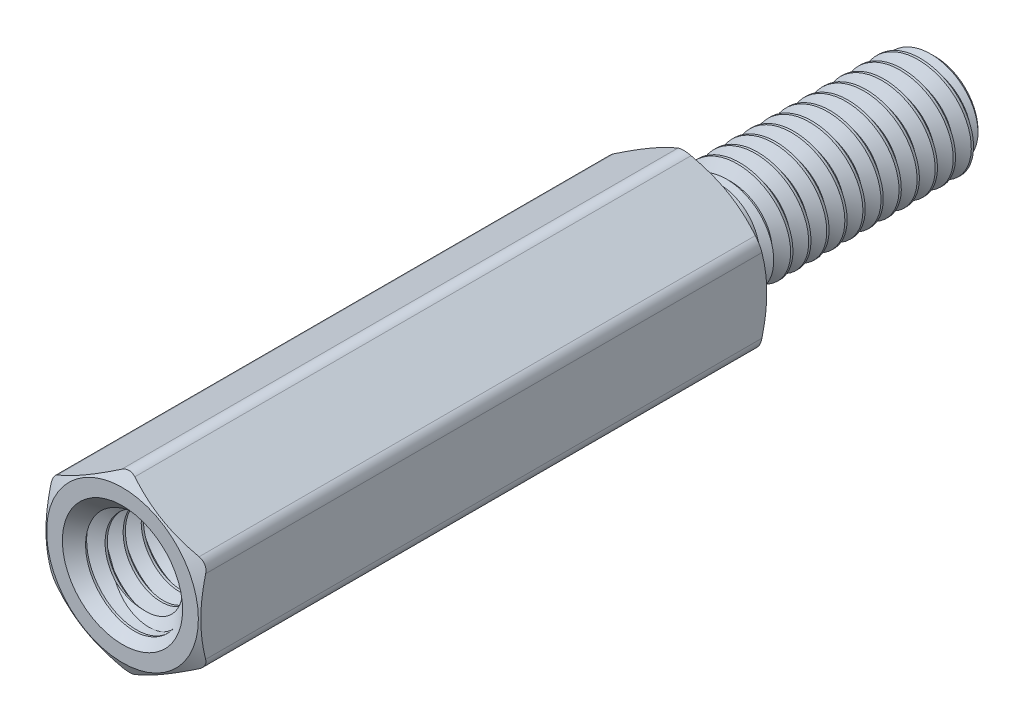
from build123d import *

# Parameters (mm, degrees)
SKETCH4_R           = 2.5
BOSS_EXTRUDE1_DEPTH = 22
SKETCH5_OUTSIDE_W   = 128.294
SKETCH5_OUTSIDE_H   = 129.222
SKETCH5_OUTSIDE_R   = 2.94
CUT_EXTRUDE1_DEPTH  = 32.831588085
CUT_EXTRUDE1_DRAFT  = -60
SKETCH6_OUTSIDE_W   = 95.872
SKETCH6_OUTSIDE_H   = 96.8
SKETCH6_OUTSIDE_R   = 2.94
CUT_EXTRUDE2_DEPTH  = 23.472205054
CUT_EXTRUDE2_DRAFT  = -60
FILLET1_R           = 0.51
CUT_SWEEP1_PITCH    = 0.7
SKETCH9_R           = 2.35
BOSS_EXTRUDE2_DEPTH = 11.1
SKETCH10_W          = 11.1
SKETCH10_H          = 2
CUT_SWEEP2_PITCH    = 0.7
CUT_SWEEP2_TO       = 11.1


with BuildPart() as part:
    # Sketch3 → Revolve1 (revolve)
    with BuildSketch(Plane(origin=(0, 0, 0), x_dir=(0, 0, -1), z_dir=(1, 0, 0))):
        with BuildLine():
            Line((-10.9, 1.65), (-10.9, 0))
            Line((-10.9, 0), (9.5, 0))
            Line((9.5, 0), (9.5, 1.65))
            Line((9.5, 1.65), (9.15, 2))
            Line((9.15, 2), (1.4025, 2))
            Line((1.4025, 2), (1.14, 1.545336663))
            Line((1.14, 1.545336663), (0.35, 1.545336663))
            ThreePointArc((0.35, 1.545336663), (0.102512627, 1.64784929), (0, 1.895336663))
            Line((0, 1.895336663), (0, 3))
            Line((0, 3), (-22, 3))
            Line((-22, 3), (-22, 2.35))
            Line((-22, 2.35), (-21.65, 2))
            Line((-21.65, 2), (-11.25, 2))
            Line((-11.25, 2), (-10.9, 1.65))
        make_face()
    revolve(axis=Axis((0, 0, -9.5), (0, 0, 1)))

    # Sketch4 → Boss-Extrude1 (add)
    with BuildSketch(Plane.XY.offset(22)):
        Polygon((-3, 1.732050808), (-3, -1.732050808), (0, -3.464101615), (3, -1.732050808), (3, 1.732050808), (0, 3.464101615), align=None)
        Circle(SKETCH4_R, mode=Mode.SUBTRACT)
    extrude(amount=-BOSS_EXTRUDE1_DEPTH)


with BuildPart() as cut_extrude1_tool:
    # Sketch5 outside → Cut-Extrude1 (with draft: the straight prism first)
    with BuildSketch(Plane.XY.offset(22)):
        Rectangle(SKETCH5_OUTSIDE_W, SKETCH5_OUTSIDE_H)
        Circle(SKETCH5_OUTSIDE_R, mode=Mode.SUBTRACT)
    extrude(amount=-CUT_EXTRUDE1_DEPTH)
    # Cut-Extrude1: the draft: its side faces are tilted about the plane it starts from
    cut_extrude1_sides = [cut_extrude1_tool.faces().sort_by_distance(p)[0] for p in [
        (0, -64.611, 5.584205958),
        (64.147, 0, 5.584205958),
        (0, 64.611, 5.584205958),
        (-64.147, 0, 5.584205958),
        (-2.94, 0, 5.584205958),
    ]]
    draft(cut_extrude1_sides, Plane.XY.offset(22), CUT_EXTRUDE1_DRAFT)


with BuildPart() as part_1:
    add(part.part)

    # Cut-Extrude1: cut by cut_extrude1_tool
    add(cut_extrude1_tool.part, mode=Mode.SUBTRACT)


with BuildPart() as cut_extrude2_tool:
    # Sketch6 outside → Cut-Extrude2 (with draft: the straight prism first)
    with BuildSketch(Plane(origin=(0, 0, 0), x_dir=(-1, 0, 0), z_dir=(0, 0, -1))):
        Rectangle(SKETCH6_OUTSIDE_W, SKETCH6_OUTSIDE_H)
        Circle(SKETCH6_OUTSIDE_R, mode=Mode.SUBTRACT)
    extrude(amount=-CUT_EXTRUDE2_DEPTH)
    # Cut-Extrude2: the draft: its side faces are tilted about the plane it starts from
    cut_extrude2_sides = [cut_extrude2_tool.faces().sort_by_distance(p)[0] for p in [
        (0, -48.4, 11.736102527),
        (-47.936, 0, 11.736102527),
        (0, 48.4, 11.736102527),
        (47.936, 0, 11.736102527),
        (2.94, 0, 11.736102527),
    ]]
    draft(cut_extrude2_sides, Plane(origin=(0, 0, 0), x_dir=(-1, 0, 0), z_dir=(0, 0, -1)), CUT_EXTRUDE2_DRAFT)


with BuildPart() as part_2:
    add(part_1.part)

    # Cut-Extrude2: cut by cut_extrude2_tool
    add(cut_extrude2_tool.part, mode=Mode.SUBTRACT)

    # Fillet1
    fillet1_edges = [part_2.edges().sort_by_distance(p)[0] for p in [
        (0, 3.464101615, 11),
        (-3, -1.732050808, 11),
        (0, -3.464101615, 11),
        (3, -1.732050808, 11),
        (3, 1.732050808, 11),
        (-3, 1.732050808, 11),
    ]]
    fillet(fillet1_edges, radius=FILLET1_R)

    # Cut-Sweep1: arcs per turn and ends read off the stored shape
    # Cut-Sweep1: the profile of Sketch7 profile screwed along a right-hand helix through 13.164286 turns, 6 arcs to a turn; built about Z, then put on its axis
    cut_sweep1_z = Axis((0, 0, 0), (0, 0, 1))
    cut_sweep1_corners = [(1.545036663, 0, -0.262673205), (1.545036663, 0, -0.349826795), (2.037888611, 0, -0.634375), (2.037888611, 0, 0.021875)]
    with BuildLine(mode=Mode.PRIVATE) as cut_sweep1_profile:
        Line(cut_sweep1_corners[0], cut_sweep1_corners[1])
        Line(cut_sweep1_corners[1], cut_sweep1_corners[2])
        Line(cut_sweep1_corners[2], cut_sweep1_corners[3])
        Line(cut_sweep1_corners[3], cut_sweep1_corners[0])
    cut_sweep1_cap = Face(cut_sweep1_profile.wire())
    cut_sweep1_turn_angles = [0, 30, 60, 90, 120, 150, 180, 210, 240, 270, 300, 330, 360]
    cut_sweep1_turn_weights = [1, 0.8660254037844387, 1, 0.8660254037844387, 1, 0.8660254037844387, 1, 0.8660254037844387, 1, 0.8660254037844387, 1, 0.8660254037844387, 1]
    cut_sweep1_turn_rails = [Edge.make_bspline([Vector(p[0], p[1], 0).rotate(cut_sweep1_z, cut_sweep1_turn_angles[k]) / cut_sweep1_turn_weights[k] + Vector(0, 0, p[2] + CUT_SWEEP1_PITCH * cut_sweep1_turn_angles[k] / 360) for k in range(13)], [0, 0, 0, 1, 1, 2, 2, 3, 3, 4, 4, 5, 5, 6, 6, 6], 2, cut_sweep1_turn_weights) for p in cut_sweep1_corners]
    cut_sweep1_turn_sides = [Face.make_surface_from_curves(cut_sweep1_turn_rails[p[0]], cut_sweep1_turn_rails[p[1]]) for p in [(0, 1), (1, 2), (2, 3), (3, 0)]]
    cut_sweep1_last_angles = [4680, 4709.571428571, 4739.142857143]
    cut_sweep1_last_weights = [1, 0.8697411331556261, 1]
    cut_sweep1_last_rails = [Edge.make_bspline([Vector(p[0], p[1], 0).rotate(cut_sweep1_z, cut_sweep1_last_angles[k]) / cut_sweep1_last_weights[k] + Vector(0, 0, p[2] + CUT_SWEEP1_PITCH * cut_sweep1_last_angles[k] / 360) for k in range(3)], [0, 0, 0, 1, 1, 1], 2, cut_sweep1_last_weights) for p in cut_sweep1_corners]
    cut_sweep1_last_sides = [Face.make_surface_from_curves(cut_sweep1_last_rails[p[0]], cut_sweep1_last_rails[p[1]]) for p in [(0, 1), (1, 2), (2, 3), (3, 0)]]
    cut_sweep1 = Plane(origin=(0, 0, -9.5), x_dir=(0, 1, 0), z_dir=(0, 0, 1)) * Solid(Shell([*[p.moved(Location((0, 0, CUT_SWEEP1_PITCH * i))) for i in range(13) for p in cut_sweep1_turn_sides], *cut_sweep1_last_sides, cut_sweep1_cap, cut_sweep1_cap.rotate(cut_sweep1_z, 4739.142857143).moved(Location((0, 0, CUT_SWEEP1_PITCH * 4739.142857143 / 360)))]))
    add(cut_sweep1, mode=Mode.SUBTRACT)

    # Sketch9 → Boss-Extrude2 (add)
    with BuildSketch(Plane.XY.offset(10.9)):
        Circle(SKETCH9_R)
    extrude(amount=BOSS_EXTRUDE2_DEPTH)


with BuildPart() as body_2:
    # Sketch10 → Revolve2 (revolve)
    with BuildSketch(Plane(origin=(0, 0, 0), x_dir=(0, 0, -1), z_dir=(1, 0, 0))):
        with Locations((-16.45, 1)):
            Rectangle(SKETCH10_W, SKETCH10_H)
    revolve(axis=Axis((0, 0, -9.5), (0, 0, 1)))

    # Cut-Sweep2: arcs per turn and ends read off the stored shape
    # Cut-Sweep2: the profile of Sketch12 profile screwed along a right-hand helix through 17.857147 turns, 6 arcs to a turn; built about Z, then put on its axis
    cut_sweep2_z = Axis((0, 0, 0), (0, 0, 1))
    cut_sweep2_corners = [(1.545036663, 0, -1.049826795), (1.545036663, 0, -0.962673205), (2.037888611, 0, -0.678125), (2.037888611, 0, -1.334375)]
    with BuildLine(mode=Mode.PRIVATE) as cut_sweep2_profile:
        Line(cut_sweep2_corners[0], cut_sweep2_corners[1])
        Line(cut_sweep2_corners[1], cut_sweep2_corners[2])
        Line(cut_sweep2_corners[2], cut_sweep2_corners[3])
        Line(cut_sweep2_corners[3], cut_sweep2_corners[0])
    cut_sweep2_cap = Face(cut_sweep2_profile.wire())
    cut_sweep2_turn_angles = [0, 30, 60, 90, 120, 150, 180, 210, 240, 270, 300, 330, 360]
    cut_sweep2_turn_weights = [1, 0.8660254037844387, 1, 0.8660254037844387, 1, 0.8660254037844387, 1, 0.8660254037844387, 1, 0.8660254037844387, 1, 0.8660254037844387, 1]
    cut_sweep2_turn_rails = [Edge.make_bspline([Vector(p[0], p[1], 0).rotate(cut_sweep2_z, cut_sweep2_turn_angles[k]) / cut_sweep2_turn_weights[k] + Vector(0, 0, p[2] + CUT_SWEEP2_PITCH * cut_sweep2_turn_angles[k] / 360) for k in range(13)], [0, 0, 0, 1, 1, 2, 2, 3, 3, 4, 4, 5, 5, 6, 6, 6], 2, cut_sweep2_turn_weights) for p in cut_sweep2_corners]
    cut_sweep2_turn_sides = [Face.make_surface_from_curves(cut_sweep2_turn_rails[p[0]], cut_sweep2_turn_rails[p[1]]) for p in [(0, 1), (1, 2), (2, 3), (3, 0)]]
    cut_sweep2_last_angles = [6120, 6150, 6180, 6210, 6240, 6270, 6300, 6330, 6360, 6390, 6420, 6424.2865, 6428.573]
    cut_sweep2_last_weights = [1, 0.8660254037844387, 1, 0.8660254037844387, 1, 0.8660254037844387, 1, 0.8660254037844387, 1, 0.8660254037844387, 1, 0.9972027722911286, 1]
    cut_sweep2_last_rails = [Edge.make_bspline([Vector(p[0], p[1], 0).rotate(cut_sweep2_z, cut_sweep2_last_angles[k]) / cut_sweep2_last_weights[k] + Vector(0, 0, p[2] + CUT_SWEEP2_PITCH * cut_sweep2_last_angles[k] / 360) for k in range(13)], [0, 0, 0, 1, 1, 2, 2, 3, 3, 4, 4, 5, 5, 6, 6, 6], 2, cut_sweep2_last_weights) for p in cut_sweep2_corners]
    cut_sweep2_last_sides = [Face.make_surface_from_curves(cut_sweep2_last_rails[p[0]], cut_sweep2_last_rails[p[1]]) for p in [(0, 1), (1, 2), (2, 3), (3, 0)]]
    cut_sweep2 = Plane(origin=(0, 0, 22), x_dir=(0, 1, 0), z_dir=(0, 0, -1)) * split(Solid(Shell([*[p.moved(Location((0, 0, CUT_SWEEP2_PITCH * i))) for i in range(17) for p in cut_sweep2_turn_sides], *cut_sweep2_last_sides, cut_sweep2_cap, cut_sweep2_cap.rotate(cut_sweep2_z, 6428.573).moved(Location((0, 0, CUT_SWEEP2_PITCH * 6428.573 / 360)))])), bisect_by=Plane.XY.offset(CUT_SWEEP2_TO), keep=Keep.BOTTOM, mode=Mode.PRIVATE)
    add(cut_sweep2, mode=Mode.SUBTRACT)


with BuildPart() as part_3:
    add(part_2.part)

    # Combine1: cut body 2
    add(body_2.part, mode=Mode.SUBTRACT)

    # Cut-Extrude3 cone 1 section (through the dimple's axis) → Cut-Extrude3 (revolve, cut)
    with BuildSketch(Plane(origin=(0, 0, 22), x_dir=(0, -1, 0), z_dir=(1, 0, 0))):
        Polygon((0, 0), (2.33, 0), (0, 2.33), align=None)
    revolve(axis=Axis((0, 0, 22), (0, 0, -1)), mode=Mode.SUBTRACT)


solid = part_3.part
